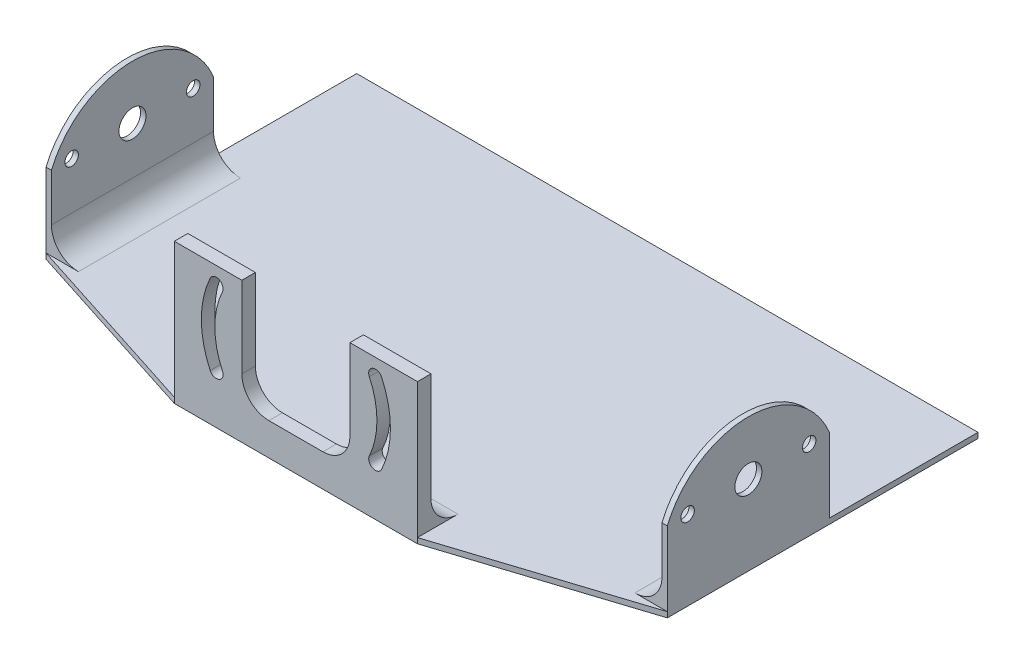
from build123d import *

# Parameters (mm, degrees)
BOSS_EXTRUDE1_DEPTH      = 2
SKETCH2_W                = 2
SKETCH2_H                = 60
BOSS_EXTRUDE2_DEPTH      = 55
SKETCH3_R                = 5
CUT_EXTRUDE1_DEPTH       = 283
SKETCH4_R                = 2.5
CUT_EXTRUDE2_DEPTH       = 283
SKETCH9_W                = 230
SKETCH9_H                = 50
BOSS_EXTRUDE3_DEPTH      = 2
SKETCH13_W               = 230
SKETCH13_H               = 10
BOSS_EXTRUDE6_DEPTH      = 20
CUT_EXTRUDE9_START       = -230
CUT_EXTRUDE9_DEPTH       = 230
CUT_EXTRUDE14_DEPTH      = 180.947909129
CUT_EXTRUDE14_DEPTH_BACK = 180.947909129
BOSS_EXTRUDE8_DEPTH      = 60
SKETCH38_W               = 90
SKETCH38_H               = 5
BOSS_EXTRUDE9_DEPTH      = 50
CUT_EXTRUDE15_DEPTH      = 50
CUT_EXTRUDE16_DEPTH      = 152.492574075
CUT_EXTRUDE16_DEPTH_BACK = 152.492574075
BOSS_EXTRUDE10_DEPTH     = 90


# Read off the part's stored shape, not the designer's step: Cut-Extrude9
with BuildPart() as part:
    # Sketch1 → Boss-Extrude1 (new body)
    with BuildSketch(Plane(origin=(0, 0, 0), x_dir=(1, 0, 0), z_dir=(0, 1, 0))):
        Polygon((115, 50), (115, 80), (-115, 80), (-115, 50), (-115, -50), (-115, -75), (115, -75), (115, -50), align=None)
    extrude(amount=BOSS_EXTRUDE1_DEPTH)

    # Sketch2 → Boss-Extrude2 (add)
    with BuildSketch(Plane(origin=(0, 2, 0), x_dir=(1, 0, 0), z_dir=(0, 1, 0))):
        with Locations((-114, 0)):
            Rectangle(SKETCH2_W, SKETCH2_H)
        with Locations((114, 0)):
            Rectangle(SKETCH2_W, SKETCH2_H)
    extrude(amount=BOSS_EXTRUDE2_DEPTH)

    # Sketch3 → Cut-Extrude1 (cut)
    with BuildSketch(Plane.ZY.offset(115)):
        with Locations((0, 29.5)):
            Circle(SKETCH3_R)
    extrude(amount=-CUT_EXTRUDE1_DEPTH, mode=Mode.SUBTRACT)

    # Sketch4 → Cut-Extrude2 (cut)
    with BuildSketch(Plane.ZY.offset(115)):
        with Locations((-22.5, 29.5)):
            Circle(SKETCH4_R)
        with Locations((22.5, 29.5)):
            Circle(SKETCH4_R)
    extrude(amount=-CUT_EXTRUDE2_DEPTH, mode=Mode.SUBTRACT)

    # Sketch9 → Boss-Extrude3 (add)
    with BuildSketch(Plane(origin=(0, 2, 0), x_dir=(1, 0, 0), z_dir=(0, 1, 0))):
        with Locations((0, 105)):
            Rectangle(SKETCH9_W, SKETCH9_H)
    extrude(amount=-BOSS_EXTRUDE3_DEPTH)

    # Sketch13 → Boss-Extrude6 (add)
    with BuildSketch(Plane.XZ):
        with Locations((0, -125)):
            Rectangle(SKETCH13_W, SKETCH13_H)
    extrude(amount=BOSS_EXTRUDE6_DEPTH)

    # Cut-Extrude9 outline → Cut-Extrude9 (cut)
    with BuildSketch(Plane(origin=(115, 0, 0), x_dir=(0, 0, -1), z_dir=(1, 0, 0)).offset(CUT_EXTRUDE9_START)):
        with BuildLine():
            Line((-30, 57), (-30, 29.5))
            ThreePointArc((-30, 29.5), (0, 49.5), (30, 29.5))
            Line((30, 29.5), (30, 57))
            Line((30, 57), (-30, 57))
        make_face()
    extrude(amount=CUT_EXTRUDE9_DEPTH, mode=Mode.SUBTRACT)

    # Sketch34 → Cut-Extrude14 (cut, two sides: drawn at the far end of the back side and taken through both)
    with BuildSketch(Plane(origin=(0, 2, 0), x_dir=(1, 0, 0), z_dir=(0, 1, 0)).offset(-CUT_EXTRUDE14_DEPTH_BACK)):
        Polygon((685.357029045, 85), (115, 85), (-115, 85), (-685.357029045, 85), (-685.357029045, 1225.71405809), (685.357029045, 1225.71405809), align=None)
    extrude(amount=CUT_EXTRUDE14_DEPTH + CUT_EXTRUDE14_DEPTH_BACK, mode=Mode.SUBTRACT)

    # Sketch37 → Boss-Extrude8 (add)
    with BuildSketch(Plane(origin=(0, 0, -30), x_dir=(-1, 0, 0), z_dir=(0, 0, -1))):
        with BuildLine():
            Line((-103, 2), (-113, 2))
            Line((-113, 2), (-113, 12))
            ThreePointArc((-113, 12), (-110.071067812, 4.928932188), (-103, 2))
        make_face()
        with BuildLine():
            Line((103, 2), (113, 2))
            Line((113, 2), (113, 12))
            ThreePointArc((113, 12), (110.071067812, 4.928932188), (103, 2))
        make_face()
    extrude(amount=-BOSS_EXTRUDE8_DEPTH)

    # Sketch38 → Boss-Extrude9 (add)
    with BuildSketch(Plane(origin=(0, 2, 0), x_dir=(1, 0, 0), z_dir=(0, 1, 0))):
        with Locations((0, -50)):
            Rectangle(SKETCH38_W, SKETCH38_H)
    extrude(amount=BOSS_EXTRUDE9_DEPTH)

    # Sketch39 → Cut-Extrude15 (cut)
    with BuildSketch(Plane.XY.offset(52.5)):
        with BuildLine():
            Line((0, 52), (-20, 52))
            Line((-20, 52), (-20, 22))
            ThreePointArc((-20, 22), (-17.071067812, 14.928932188), (-10, 12))
            Line((-10, 12), (10, 12))
            ThreePointArc((10, 12), (17.071067812, 14.928932188), (20, 22))
            Line((20, 22), (20, 52))
            Line((20, 52), (0, 52))
        make_face()
        with BuildLine():
            ThreePointArc((27.189233611, 19.321452148), (30, 32), (27.189233611, 44.678547852))
            ThreePointArc((27.189233611, 44.678547852), (28.398457424, 48.000862974), (31.720772546, 46.791639161))
            ThreePointArc((31.720772546, 46.791639161), (35, 32), (31.720772546, 17.208360839))
            ThreePointArc((31.720772546, 17.208360839), (28.398457424, 15.999137026), (27.189233611, 19.321452148))
        make_face()
        with BuildLine():
            ThreePointArc((-27.189233611, 19.321452148), (-28.398457424, 15.999137026), (-31.720772546, 17.208360839))
            ThreePointArc((-31.720772546, 17.208360839), (-35, 32), (-31.720772546, 46.791639161))
            ThreePointArc((-31.720772546, 46.791639161), (-28.398457424, 48.000862974), (-27.189233611, 44.678547852))
            ThreePointArc((-27.189233611, 44.678547852), (-30, 32), (-27.189233611, 19.321452148))
        make_face()
    extrude(amount=-CUT_EXTRUDE15_DEPTH, mode=Mode.SUBTRACT)

    # Sketch40 → Cut-Extrude16 (cut, two sides: drawn at the far end of the back side and taken through both)
    with BuildSketch(Plane(origin=(0, 2, 0), x_dir=(1, 0, 0), z_dir=(0, 1, 0)).offset(-CUT_EXTRUDE16_DEPTH_BACK)):
        Polygon((-614.144418911, 130.439277507), (-115, -30), (-45, -52.5), (45, -52.5), (115, -30), (614.144418911, 130.439277507), (614.144418911, -918.151992143), (-614.144418911, -918.151992143), align=None)
    extrude(amount=CUT_EXTRUDE16_DEPTH + CUT_EXTRUDE16_DEPTH_BACK, mode=Mode.SUBTRACT)

    # Sketch41 → Boss-Extrude10 (add)
    with BuildSketch(Plane.ZY.offset(45)):
        with BuildLine():
            Line((37.5, 2), (47.5, 2))
            Line((47.5, 2), (47.5, 12))
            ThreePointArc((47.5, 12), (44.571067812, 4.928932188), (37.5, 2))
        make_face()
    extrude(amount=-BOSS_EXTRUDE10_DEPTH)


solid = part.part
